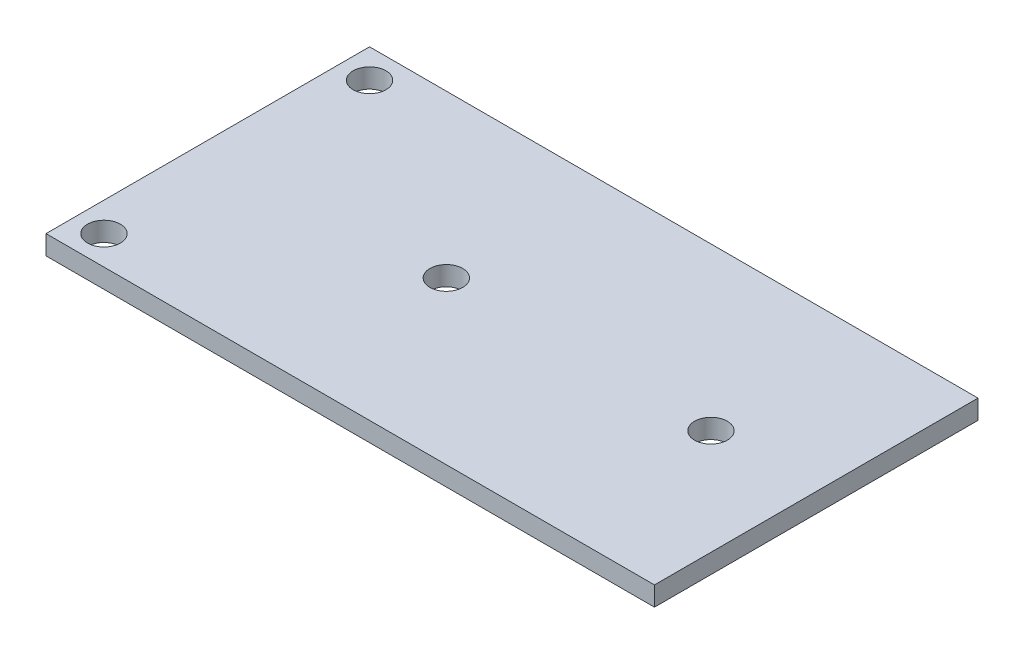
from build123d import *

# Parameters (mm, degrees)
SKETCH1_W            = 63
SKETCH1_H            = 33.5
BOSS_EXTRUDE1_DEPTH  = 2
M3_CLEARANCE_HOLE1_D = 3.4
M3_CLEARANCE_HOLE2_D = 3.4


with BuildPart() as part:
    # Sketch1 → Boss-Extrude1 (new body)
    with BuildSketch(Plane(origin=(0, 0, 0), x_dir=(1, 0, 0), z_dir=(0, 1, 0))):
        with Locations((-40.686085356, 13.7444519)):
            Rectangle(SKETCH1_W, SKETCH1_H)
    extrude(amount=BOSS_EXTRUDE1_DEPTH)

    # M3 Clearance Hole1 (through all)
    with Locations(Plane(origin=(0, 2, 0), x_dir=(1, 0, 0), z_dir=(0, 1, 0))):
        with Locations((-69.186085356, 27.4944519), (-69.186085356, -0.0055481)):
            Hole(M3_CLEARANCE_HOLE1_D / 2)

    # M3 Clearance Hole2 (through all)
    with Locations(Plane(origin=(-47.486085356, 2, -13.7444519), x_dir=(0, 0, 1), z_dir=(0, 1, 0))):
        with Locations((0, 0), (0, 27.4)):
            Hole(M3_CLEARANCE_HOLE2_D / 2)


solid = part.part
